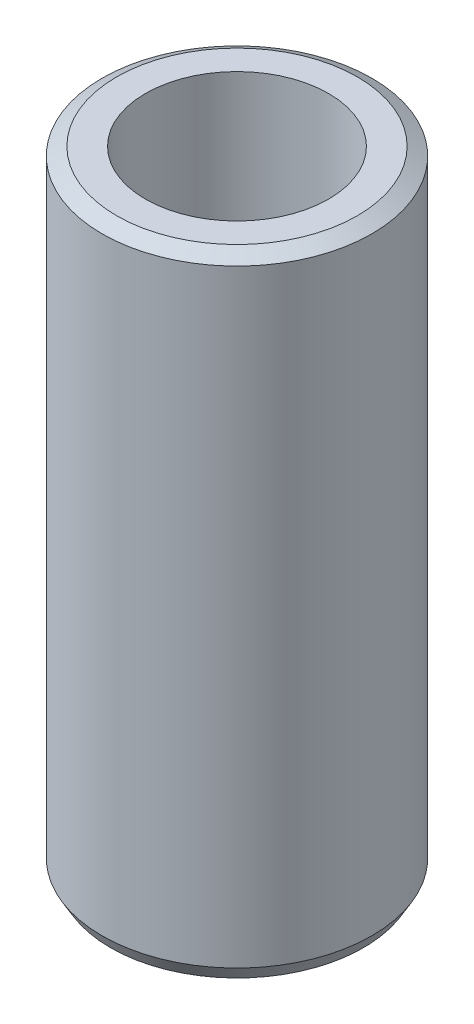
from build123d import *
from OCP.BRepFilletAPI import BRepFilletAPI_MakeChamfer

# Parameters (mm, degrees)
SKETCH1_R           = 45
BOSS_EXTRUDE1_DEPTH = 210.496306697
SKETCH2_R           = 30.549215029
CUT_EXTRUDE1_DEPTH  = 220.906105266
CHAMFER1_SIZE       = 2.802181853
CHAMFER1_SIZE2      = 4.853521342


with BuildPart() as part:
    # Sketch1 → Boss-Extrude1 (new body)
    with BuildSketch(Plane(origin=(0, 0, 0), x_dir=(1, 0, 0), z_dir=(0, 1, 0))):
        Circle(SKETCH1_R)
    extrude(amount=BOSS_EXTRUDE1_DEPTH)

    # Sketch2 → Cut-Extrude1 (cut, through all)
    with BuildSketch(Plane(origin=(0, 0, 0), x_dir=(1, 0, 0), z_dir=(0, 1, 0))):
        Circle(SKETCH2_R)
    extrude(amount=CUT_EXTRUDE1_DEPTH, mode=Mode.SUBTRACT)

    # Chamfer1: one chamfer whose edges measure the first distance from different faces: ONE call of the kernel's chamfer builder (chamfer() names one face for all edges)
    chamfer1_edges_1 = [part.edges().sort_by_distance(p)[0] for p in [
        (-45, 210.496306697, 0),
    ]]
    chamfer1_side_1 = [part.faces().sort_by_distance(p)[0] for p in [
        (-45, 105.248153349, 0),
    ]]
    chamfer1_edges_2 = [part.edges().sort_by_distance(p)[0] for p in [
        (-45, 0, 0),
    ]]
    chamfer1_side_2 = [part.faces().sort_by_distance(p)[0] for p in [
        (-43.727207794, 0, 0),
    ]]
    chamfer1 = BRepFilletAPI_MakeChamfer(part.part.solid().wrapped)
    for e in chamfer1_edges_1:
        chamfer1.Add(CHAMFER1_SIZE, CHAMFER1_SIZE2, e.wrapped, chamfer1_side_1[0].wrapped)  # the first distance lies on this face
    for e in chamfer1_edges_2:
        chamfer1.Add(CHAMFER1_SIZE, CHAMFER1_SIZE2, e.wrapped, chamfer1_side_2[0].wrapped)  # the first distance lies on this face
    add(Compound.cast(chamfer1.Shape()), mode=Mode.REPLACE)


solid = part.part
